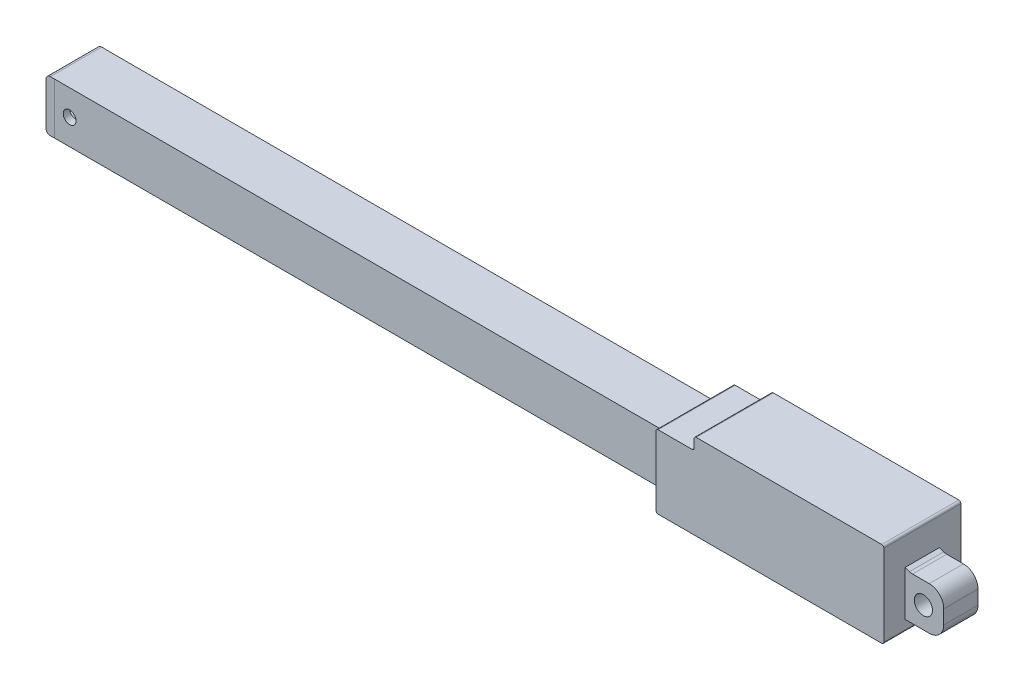
from build123d import *

# Parameters (mm, degrees)
SKETCH2_R           = 2.125
BOSS_EXTRUDE1_DEPTH = 9
SKETCH2_3_W         = 143.4775
SKETCH2_3_H         = 11.945
SKETCH2_3_R         = 1.5
BOSS_EXTRUDE2_DEPTH = 5.975
BOSS_EXTRUDE3_DEPTH = 6
SKETCH7_R           = 4.45
CUT_EXTRUDE4_DEPTH  = 138
CUT_EXTRUDE6_DEPTH  = 5
CUT_EXTRUDE7_DEPTH  = 5


with BuildPart() as part:
    # Sketch2 → Boss-Extrude1 (new, symmetric)
    with BuildSketch(Plane.XY):
        with BuildLine():
            Line((145.4775, 14.0125), (145.4775, 11.945))
            Line((145.4775, 11.945), (145.4775, 0))
            Line((145.4775, 0), (145.4775, -2.0675))
            ThreePointArc((145.4775, -2.0675), (145.623946609, -2.421053391), (145.9775, -2.5675))
            Line((145.9775, -2.5675), (198.1775, -2.5675))
            ThreePointArc((198.1775, -2.5675), (198.531053391, -2.421053391), (198.6775, -2.0675))
            Line((198.6775, -2.0675), (198.6775, 0))
            Line((198.6775, 0), (204.28834363, 0))
            ThreePointArc((204.28834363, 0), (206.684839082, 0.992660918), (207.6775, 3.38915637))
            Line((207.6775, 3.38915637), (207.6775, 6.65334363))
            ThreePointArc((207.6775, 6.65334363), (206.684839082, 9.049839082), (204.28834363, 10.0425))
            Line((204.28834363, 10.0425), (200.377364582, 10.0425))
            ThreePointArc((200.377364582, 10.0425), (200.021766481, 10.074366369), (199.6775, 10.168950009))
            Line((199.6775, 10.168950009), (198.6775, 10.5425))
            Line((198.6775, 10.5425), (198.6775, 16.9225))
            ThreePointArc((198.6775, 16.9225), (198.531053391, 17.276053391), (198.1775, 17.4225))
            Line((198.1775, 17.4225), (154.8775, 17.4225))
            ThreePointArc((154.8775, 17.4225), (154.523946609, 17.276053391), (154.3775, 16.9225))
            Line((154.3775, 16.9225), (154.3775, 15.0125))
            ThreePointArc((154.3775, 15.0125), (154.231053391, 14.658946609), (153.8775, 14.5125))
            Line((153.8775, 14.5125), (145.9775, 14.5125))
            ThreePointArc((145.9775, 14.5125), (145.623946609, 14.366053391), (145.4775, 14.0125))
        make_face()
        with Locations((202.9275, 5.02125)):
            Circle(SKETCH2_R, mode=Mode.SUBTRACT)
    extrude(amount=BOSS_EXTRUDE1_DEPTH, both=True)

    # Sketch2<3> → Boss-Extrude2 (add, symmetric)
    with BuildSketch(Plane.XY):
        with Locations((73.73875, 5.9725)):
            Rectangle(SKETCH2_3_W, SKETCH2_3_H)
        with Locations((5.5, 5.9725)):
            Circle(SKETCH2_3_R, mode=Mode.SUBTRACT)
    extrude(amount=BOSS_EXTRUDE2_DEPTH, both=True)

    # Sketch2<4> → Boss-Extrude3 (add, symmetric)
    with BuildSketch(Plane.XY):
        with BuildLine():
            Line((2, 0), (2, 11.945))
            Line((2, 11.945), (1, 11.945))
            ThreePointArc((1, 11.945), (0.292893219, 11.652106781), (0, 10.945))
            Line((0, 10.945), (0, 1))
            ThreePointArc((0, 1), (0.292893219, 0.292893219), (1, 0))
            Line((1, 0), (2, 0))
        make_face()
    extrude(amount=BOSS_EXTRUDE3_DEPTH, both=True)

    # Sketch7 → Cut-Extrude4 (cut)
    with BuildSketch(Plane.ZY):
        with Locations((0, 5.9725)):
            Circle(SKETCH7_R)
    extrude(amount=-CUT_EXTRUDE4_DEPTH, mode=Mode.SUBTRACT)

    # Sketch8 → Cut-Extrude6 (cut, symmetric)
    with BuildSketch(Plane.XY.offset(9)):
        Polygon((198.6775, 10.5425), (211.452070609, 15.905902501), (207.012502563, -2.059702975), (198.6775, 0), align=None)
    extrude(amount=CUT_EXTRUDE6_DEPTH, both=True, mode=Mode.SUBTRACT)

    # Sketch10 → Cut-Extrude7 (cut, symmetric)
    with BuildSketch(Plane(origin=(0, 0, -9), x_dir=(-1, 0, 0), z_dir=(0, 0, -1))):
        Polygon((-198.6775, 10.5425), (-218.686725566, 39.11278538), (-201.443333916, -35.592944689), (-198.6775, 0), align=None)
    extrude(amount=CUT_EXTRUDE7_DEPTH, both=True, mode=Mode.SUBTRACT)


solid = part.part
